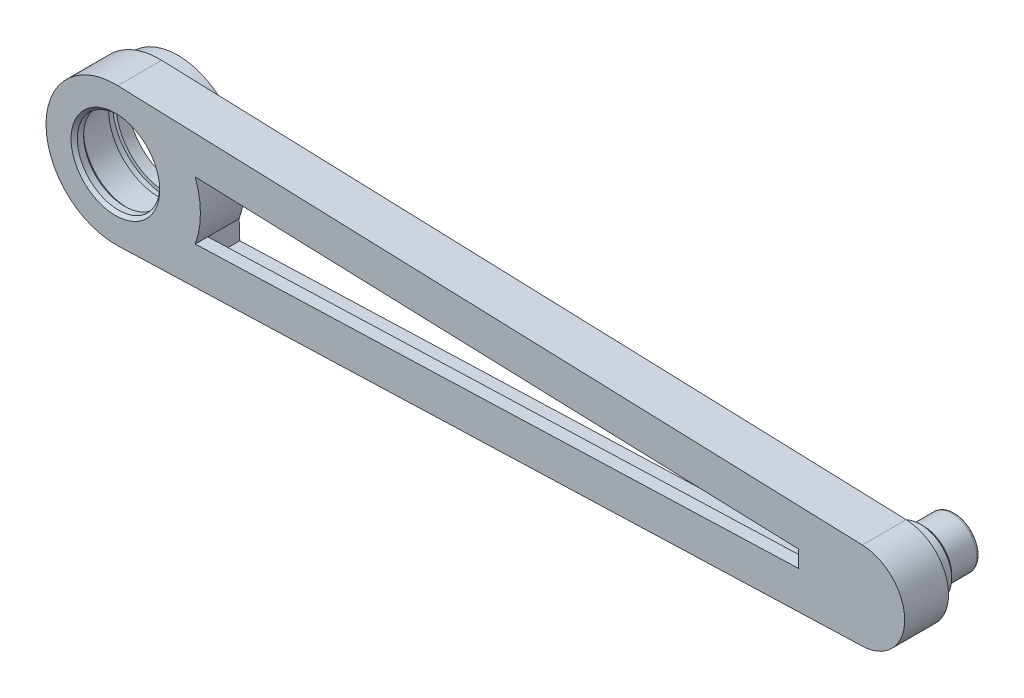
from build123d import *

# Parameters (mm, degrees)
SKETCH_1_R          = 8.075
EXTRUDE_1_DEPTH     = 7
EXTRUDE_START       = -2
SKETCH_2_R          = 8.075
SKETCH_2_R_2        = 6.575
EXTRUDE_2_DEPTH     = 2
SKETCH_3_R          = 4
EXTRUDE_3_DEPTH     = 10
SKETCH_4_R          = 5
SKETCH_4_R_2        = 4
EXTRUDE_4_DEPTH     = 3
CHAMFER_1_SIZE      = 0.5
CUT_EXTRUDE_1_DEPTH = 7
CUT_EXTRUDE_2_DEPTH = 5
CUT_EXTRUDE_START   = -2
SKETCH_8_R          = 4
CUT_EXTRUDE_3_DEPTH = 2
FILLET_1_R          = 0.5
SKETCH_9_R          = 2.2
CUT_EXTRUDE_4_DEPTH = 10
EXTRUDE_START_2     = 3
SKETCH_10_R         = 10.075
SKETCH_10_R_2       = 8.075
EXTRUDE_5_DEPTH     = 3


with BuildPart() as part:
    # 草图1 → 凸台-拉伸1 (new body)
    with BuildSketch(Plane.XY):
        with BuildLine():
            ThreePointArc((0.37924895, 11.068504652), (-11.074999998, -0.000191538), (0.379631801, -11.068491528))
            Line((0.379631801, -11.068491528), (119, -7))
            ThreePointArc((119, -7), (125.998973572, -0.119870518), (119.239705882, 6.995894588))
            Line((119.239705882, 6.995894588), (0.37924895, 11.068504652))
        make_face()
        Circle(SKETCH_1_R, mode=Mode.SUBTRACT)
    extrude(amount=EXTRUDE_1_DEPTH)

    # 草图2 → 凸台-拉伸2 (add)
    with BuildSketch(Plane.XY.offset(7).offset(EXTRUDE_START)):
        Circle(SKETCH_2_R)
        Circle(SKETCH_2_R_2, mode=Mode.SUBTRACT)
    extrude(amount=EXTRUDE_2_DEPTH)

    # 草图3 → 凸台-拉伸3 (add)
    with BuildSketch(Plane(origin=(0, 0, 0), x_dir=(-1, 0, 0), z_dir=(0, 0, -1))):
        with Locations((-119, 0)):
            Circle(SKETCH_3_R)
    extrude(amount=EXTRUDE_3_DEPTH)

    # 草图4 → 凸台-拉伸4 (add)
    with BuildSketch(Plane(origin=(0, 0, 0), x_dir=(-1, 0, 0), z_dir=(0, 0, -1))):
        with Locations(Location((-119, 0, 0), (0, 0, 180))):
            Circle(SKETCH_4_R)
        with Locations((-119, 0)):
            Circle(SKETCH_4_R_2, mode=Mode.SUBTRACT)
    extrude(amount=EXTRUDE_4_DEPTH)

    # 倒角1
    chamfer_1_edges = [part.edges().sort_by_distance(p)[0] for p in [
        (-6.575, 0, 5),
        (-6.575, 0, 7),
        (123, 0, -10),
        (114, 0, -3),
    ]]
    chamfer(chamfer_1_edges, length=CHAMFER_1_SIZE)

    # 草图5 → 切除-拉伸1 (cut)
    with BuildSketch(Plane(origin=(0, 0, 0), x_dir=(-1, 0, 0), z_dir=(0, 0, -1))):
        with BuildLine():
            ThreePointArc((-12.757234161, -4.640431182), (-13.574999998, 0.000234775), (-12.757073645, 4.640872443))
            Line((-12.757073645, 4.640872443), (-109.090204802, 1.340134001))
            ThreePointArc((-109.090204802, 1.340134001), (-109.022576686, 0.671583213), (-109, 0))
            ThreePointArc((-109, 0), (-109.022449652, -0.669693251), (-109.08969781, -1.336379625))
            Line((-109.08969781, -1.336379625), (-12.757234161, -4.640431182))
        make_face()
    extrude(amount=-CUT_EXTRUDE_1_DEPTH, mode=Mode.SUBTRACT)

    # 草图6 → 切除-拉伸2 (cut)
    with BuildSketch(Plane(origin=(0, 0, 0), x_dir=(-1, 0, 0), z_dir=(0, 0, -1))):
        Polygon((-109.08969781, -1.336379625), (-12.757234161, -4.640431182), (-12.860068961, -7.638668165), (-109.192532609, -4.334616608), align=None)
        Polygon((-12.757073645, 4.640872443), (-109.090204802, 1.340134001), (-109.192935895, 4.338374538), (-12.859804737, 7.63911298), align=None)
    extrude(amount=-CUT_EXTRUDE_2_DEPTH, mode=Mode.SUBTRACT)

    # 草图8 → 切除-拉伸3 (cut)
    with BuildSketch(Plane(origin=(0, 0, -10), x_dir=(-1, 0, 0), z_dir=(0, 0, -1)).offset(CUT_EXTRUDE_START)):
        with Locations((-119, 0)):
            Circle(SKETCH_8_R)
    extrude(amount=CUT_EXTRUDE_3_DEPTH, mode=Mode.SUBTRACT)

    # 圆角1
    fillet_1_edges = [part.edges().sort_by_distance(p)[0] for p in [
        (123, 0, -8),
    ]]
    fillet(fillet_1_edges, radius=FILLET_1_R)

    # 草图9 → 切除-拉伸4 (cut)
    with BuildSketch(Plane(origin=(0, 0, -8), x_dir=(-1, 0, 0), z_dir=(0, 0, -1))):
        with Locations((-119, 0)):
            Circle(SKETCH_9_R)
    extrude(amount=-CUT_EXTRUDE_4_DEPTH, mode=Mode.SUBTRACT)

    # 草图10 → 凸台-拉伸5 (add)
    with BuildSketch(Plane(origin=(0, 0, 0), x_dir=(-1, 0, 0), z_dir=(0, 0, -1)).offset(EXTRUDE_START_2)):
        with Locations(Location((0, 0, 0), (0, 0, 180))):
            Circle(SKETCH_10_R)
        Circle(SKETCH_10_R_2, mode=Mode.SUBTRACT)
    extrude(amount=-EXTRUDE_5_DEPTH)

    # 切除-旋转2: read off the stored shape, not the designer's step
    # 切除-旋转2: loft between two sections, ruled curve by curve
    cut_revolve_2_from = [
        Edge.make_three_point_arc((8.65, 0, -1.2), (0, 8.65, -1.2), (-8.65, 0, -1.2)),
        Edge.make_three_point_arc((-8.65, 0, -1.2), (0, -8.65, -1.2), (8.65, 0, -1.2)),
    ]
    cut_revolve_2_to = [
        Edge.make_three_point_arc((8.65, 0, 0), (0, 8.65, 0), (-8.65, 0, 0)),
        Edge.make_three_point_arc((-8.65, 0, 0), (0, -8.65, 0), (8.65, 0, 0)),
    ]
    cut_revolve_2 = Solid(Shell([*[Face.make_surface_from_curves(cut_revolve_2_from[k], cut_revolve_2_to[k]) for k in range(2)], Face(Wire(cut_revolve_2_from)), Face(Wire(cut_revolve_2_to))]))
    add(cut_revolve_2, mode=Mode.SUBTRACT)


solid = part.part
